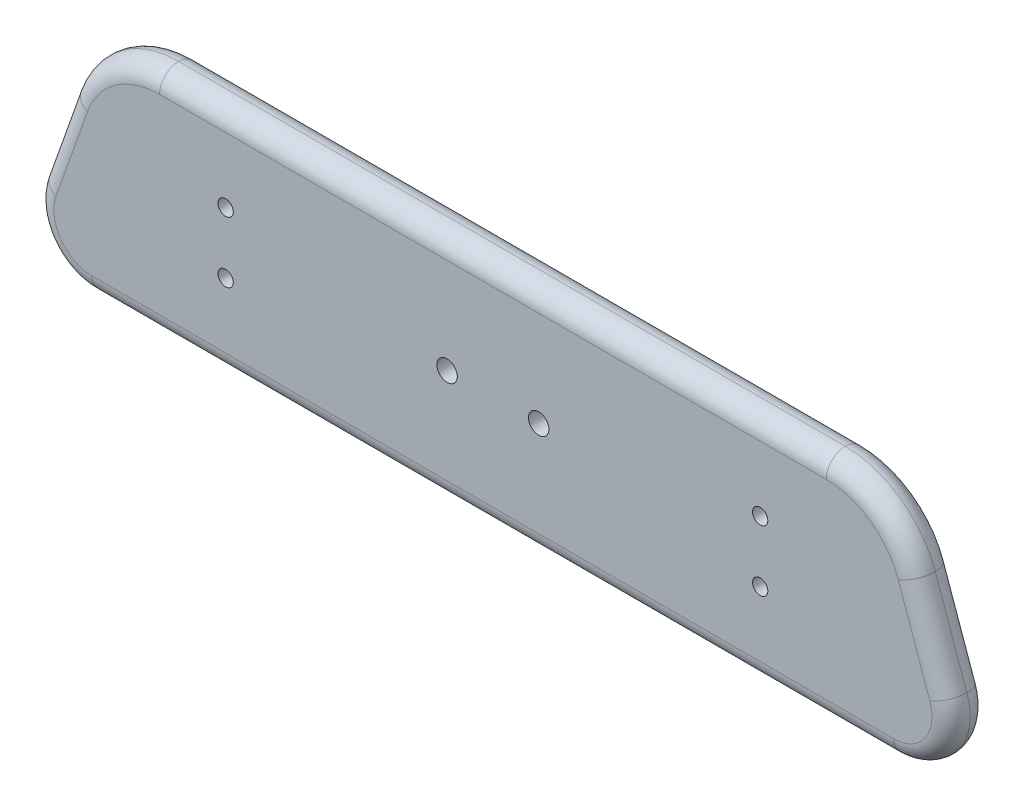
from build123d import *

# Parameters (mm, degrees)
BOSS_EXTRUDE1_DEPTH = 10
SKETCH2_R           = 2
CUT_EXTRUDE1_DEPTH  = 8
FILLET1_R           = 5
SKETCH3_W           = 46
SKETCH3_H           = 40
CUT_EXTRUDE2_DEPTH  = 4
SKETCH4_R           = 2.672212582
CUT_EXTRUDE3_DEPTH  = 135.298175803


with BuildPart() as part:
    # Sketch1 → Boss-Extrude1 (new body)
    with BuildSketch(Plane.XY):
        with BuildLine():
            Line((0, 0), (-105, 0))
            ThreePointArc((-105, 0), (-117.249623327, 6.342822149), (-119.139622366, 20.007102889))
            Line((-119.139622366, 20.007102889), (-110.875178831, 43.345171481))
            ThreePointArc((-110.875178831, 43.345171481), (-101.737771304, 55.416038879), (-87.309141554, 60))
            Line((-87.309141554, 60), (87.309141554, 60))
            ThreePointArc((87.309141554, 60), (101.737771304, 55.416038879), (110.875178831, 43.345171481))
            Line((110.875178831, 43.345171481), (119.139622366, 20.007102889))
            ThreePointArc((119.139622366, 20.007102889), (117.249623327, 6.342822149), (105, 0))
            Line((105, 0), (0, 0))
        make_face()
    extrude(amount=BOSS_EXTRUDE1_DEPTH)

    # Sketch2 → Cut-Extrude1 (cut)
    with BuildSketch(Plane.XY.offset(10)):
        with Locations((-70, 22)):
            Circle(SKETCH2_R)
        with Locations((-70, 38)):
            Circle(SKETCH2_R)
        with Locations(Location((70, 22, 0), (0, 0, 180))):
            Circle(SKETCH2_R)
        with Locations(Location((70, 38, 0), (0, 0, 180))):
            Circle(SKETCH2_R)
    extrude(amount=-CUT_EXTRUDE1_DEPTH, mode=Mode.SUBTRACT)

    # Fillet1
    fillet1_edges = [part.edges().sort_by_distance(p)[0] for p in [
        (-117.249623327, 6.342822149, 0),
        (-115.007400599, 31.676137185, 0),
        (-101.737771304, 55.416038879, 0),
        (0, 60, 0),
        (101.737771304, 55.416038879, 0),
        (115.007400599, 31.676137185, 0),
        (117.249623327, 6.342822149, 0),
        (-117.249623327, 6.342822149, 10),
        (-115.007400599, 31.676137185, 10),
        (-101.737771304, 55.416038879, 10),
        (0, 60, 10),
        (101.737771304, 55.416038879, 10),
        (115.007400599, 31.676137185, 10),
        (117.249623327, 6.342822149, 10),
        (0, 0, 0),
        (0, 0, 10),
    ]]
    fillet(fillet1_edges, radius=FILLET1_R - 0.0001)  # a hair under: the kernel refuses the full size

    # Sketch3 → Cut-Extrude2 (cut)
    with BuildSketch(Plane(origin=(0, 0, 0), x_dir=(-1, 0, 0), z_dir=(0, 0, -1))):
        with Locations((0, 30)):
            Rectangle(SKETCH3_W, SKETCH3_H)
    extrude(amount=-CUT_EXTRUDE2_DEPTH, mode=Mode.SUBTRACT)

    # Sketch4 → Cut-Extrude3 (cut, through all)
    with BuildSketch(Plane(origin=(0, 0, 4), x_dir=(-1, 0, 0), z_dir=(0, 0, -1))):
        with Locations((-12, 30)):
            Circle(SKETCH4_R)
        with Locations((12, 30)):
            Circle(SKETCH4_R)
    extrude(amount=-CUT_EXTRUDE3_DEPTH, mode=Mode.SUBTRACT)


solid = part.part
